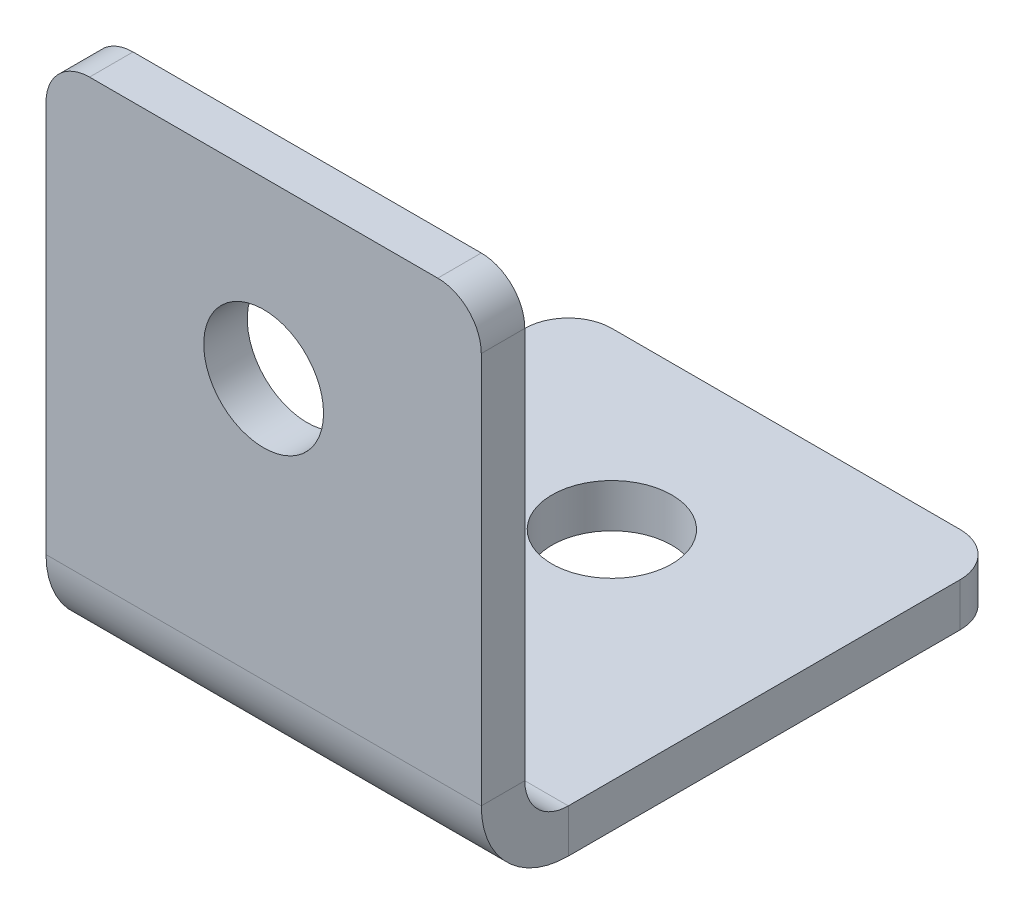
from build123d import *

# Parameters (mm, degrees)
BASE_FLANGE1_DEPTH = 31.75
SKETCH6_R          = 4.3688
CUT_EXTRUDE1_DEPTH = 63.540247041
SKETCH7_R          = 4.3688
CUT_EXTRUDE2_DEPTH = 63.540247041
FILLET1_R          = 3.175


# Sheet-metal steps are written as plain solids
with BuildPart() as part:
    # Sketch1 → Base-Flange1 (new body)
    with BuildSketch(Plane(origin=(0, 0, 0), x_dir=(0, 0, -1), z_dir=(1, 0, 0))):
        with BuildLine():
            Line((38.1, 0), (6.35, 0))
            ThreePointArc((6.35, 0), (1.859871939, 1.859871939), (0, 6.35))
            Line((0, 6.35), (0, 38.1))
            Line((0, 38.1), (3.175, 38.1))
            Line((3.175, 38.1), (3.175, 6.35))
            ThreePointArc((3.175, 6.35), (4.10493597, 4.10493597), (6.35, 3.175))
            Line((6.35, 3.175), (38.1, 3.175))
            Line((38.1, 3.175), (38.1, 0))
        make_face()
    extrude(amount=BASE_FLANGE1_DEPTH)

    # Sketch6 → Cut-Extrude1 (cut, through all)
    with BuildSketch(Plane.XY):
        with Locations((15.875, 25.4)):
            Circle(SKETCH6_R)
    extrude(amount=-CUT_EXTRUDE1_DEPTH, mode=Mode.SUBTRACT)

    # Sketch7 → Cut-Extrude2 (cut, through all)
    with BuildSketch(Plane.XZ):
        with Locations(Location((15.875, -25.4, 0), (0, 0, 270))):
            Circle(SKETCH7_R)
    extrude(amount=-CUT_EXTRUDE2_DEPTH, mode=Mode.SUBTRACT)

    # Fillet1
    fillet1_edges = [part.edges().sort_by_distance(p)[0] for p in [
        (31.75, 38.1, -1.5875),
        (0, 38.1, -1.5875),
        (31.75, 1.5875, -38.1),
        (0, 1.5875, -38.1),
    ]]
    fillet(fillet1_edges, radius=FILLET1_R)


solid = part.part
